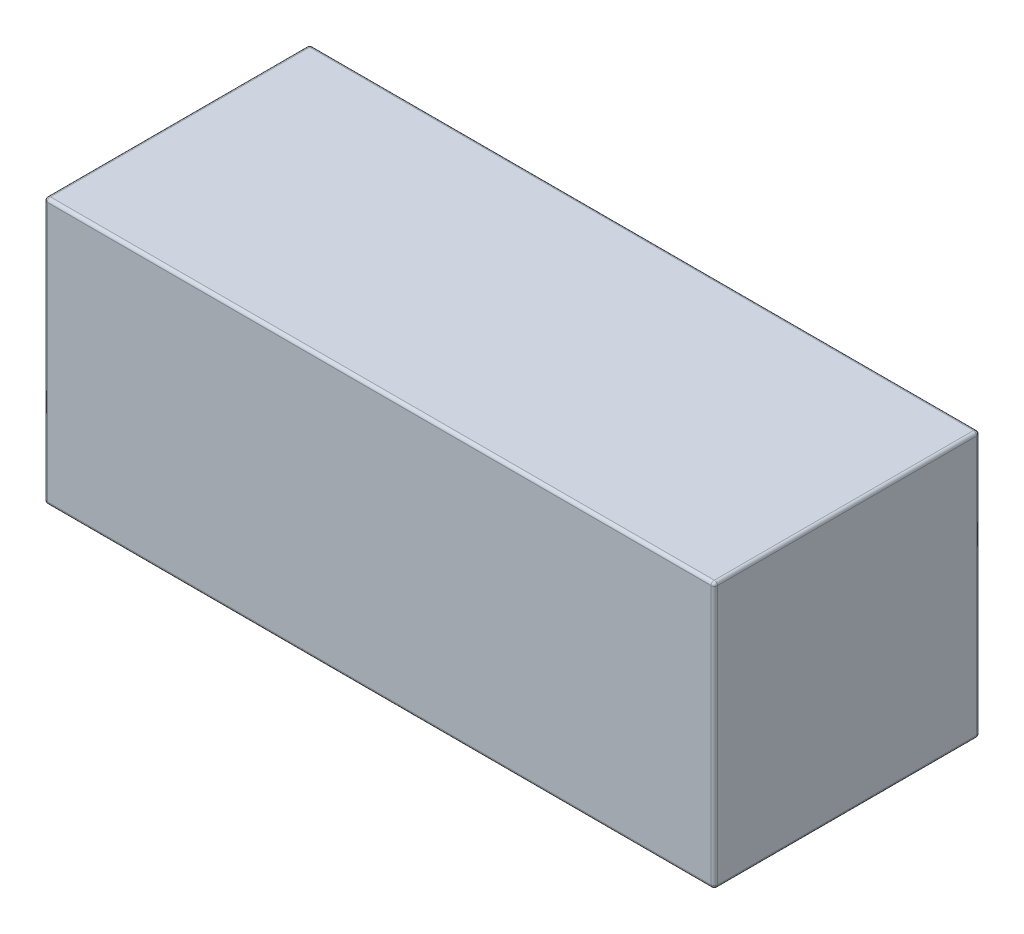
from build123d import *

# Parameters (mm, degrees)
ESQUISSE1_W             = 106
ESQUISSE1_H             = 42
BOSS_EXTRU_1_DEPTH      = 42
ESQUISSE2_W             = 10.5
ESQUISSE2_H             = 10.5
ENL_V_MAT_EXTRU_1_DEPTH = 4.5
CONG_1_R                = 0.5


with BuildPart() as part:
    # Esquisse1 → Boss.-Extru.1 (new body)
    with BuildSketch(Plane.XY):
        with Locations((53, -21)):
            Rectangle(ESQUISSE1_W, ESQUISSE1_H)
    extrude(amount=BOSS_EXTRU_1_DEPTH)

    # Esquisse2 → Enlèv. mat.-Extru.1 (cut)
    with BuildSketch(Plane.XZ.offset(42)):
        with Locations((65, 33)):
            Rectangle(ESQUISSE2_W, ESQUISSE2_H)
        with Locations((65, 9)):
            Rectangle(ESQUISSE2_W, ESQUISSE2_H)
    enl_v_mat_extru_1 = extrude(amount=-ENL_V_MAT_EXTRU_1_DEPTH, mode=Mode.SUBTRACT)

    # Congé1
    cong_1_edges = [part.edges().sort_by_distance(p)[0] for p in [
        (0, -42, 21),
        (53, -42, 42),
        (0, -21, 42),
        (106, -42, 21),
        (106, -21, 42),
        (53, -42, 0),
        (106, -21, 0),
        (0, -21, 0),
        (106, 0, 21),
        (53, 0, 42),
        (0, 0, 21),
        (53, 0, 0),
    ]]
    fillet(cong_1_edges, radius=CONG_1_R)

    # Symétrie1: Enlèv. mat.-Extru.1 across plane
    add(enl_v_mat_extru_1.mirror(Plane(origin=(53, 0, 0), x_dir=(0, 0, 1), z_dir=(1, 0, 0))), mode=Mode.SUBTRACT)


solid = part.part
